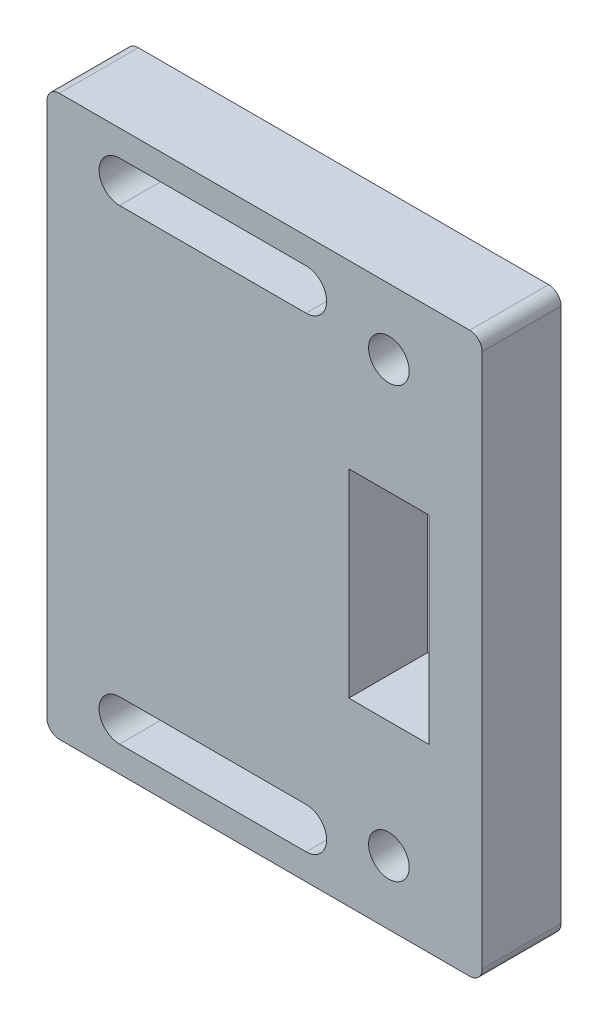
from build123d import *

# Parameters (mm, degrees)
SKETCH1_W                                        = 70
SKETCH1_H                                        = 90
BOSS_EXTRUDE1_DEPTH                              = 12.7
CSK_FOR_1_4_FLAT_HEAD_MACHINE_SCREW1_D           = 6.5278
CSK_FOR_1_4_FLAT_HEAD_MACHINE_SCREW1_CSINK_D     = 12.8778
CSK_FOR_1_4_FLAT_HEAD_MACHINE_SCREW1_CSINK_ANGLE = 82
FILLET1_R                                        = 2
CUT_EXTRUDE1_DEPTH                               = 115.72266559


with BuildPart() as part:
    # Sketch1 → Boss-Extrude1 (new body)
    with BuildSketch(Plane.XY):
        with Locations((35, -45)):
            Rectangle(SKETCH1_W, SKETCH1_H)
        Polygon((55, -29.025), (61.45, -29.025), (61.45, -60.975), (55, -60.975), (48.55, -60.975), (48.55, -29.025), align=None, mode=Mode.SUBTRACT)
    extrude(amount=BOSS_EXTRUDE1_DEPTH)

    # CSK for 1/4 Flat Head Machine Screw1 (through all)
    with Locations(Plane(origin=(0, 0, 0), x_dir=(-1, 0, 0), z_dir=(0, 0, -1))):
        with Locations((-55, -10.579610023), (-55, -79.699610023)):
            CounterSinkHole(CSK_FOR_1_4_FLAT_HEAD_MACHINE_SCREW1_D / 2, CSK_FOR_1_4_FLAT_HEAD_MACHINE_SCREW1_CSINK_D / 2, counter_sink_angle=CSK_FOR_1_4_FLAT_HEAD_MACHINE_SCREW1_CSINK_ANGLE)

    # Fillet1
    fillet1_edges = [part.edges().sort_by_distance(p)[0] for p in [
        (0, 0, 6.35),
        (70, 0, 6.35),
        (0, -90, 6.35),
        (70, -90, 6.35),
    ]]
    fillet(fillet1_edges, radius=FILLET1_R)

    # Sketch7 → Cut-Extrude1 (cut, through all)
    with BuildSketch(Plane(origin=(0, 0, 0), x_dir=(-1, 0, 0), z_dir=(0, 0, -1))):
        with BuildLine():
            Line((-41.687469931, -85.815), (-11.687469931, -85.815))
            ThreePointArc((-11.687469931, -85.815), (-8.387469931, -82.515), (-11.687469931, -79.215))
            Line((-11.687469931, -79.215), (-41.687469931, -79.215))
            ThreePointArc((-41.687469931, -79.215), (-44.987469931, -82.515), (-41.687469931, -85.815))
        make_face()
        with BuildLine():
            Line((-11.687469931, -10.785), (-41.687469931, -10.785))
            ThreePointArc((-41.687469931, -10.785), (-44.987469931, -7.485), (-41.687469931, -4.185))
            Line((-41.687469931, -4.185), (-11.687469931, -4.185))
            ThreePointArc((-11.687469931, -4.185), (-8.387469931, -7.485), (-11.687469931, -10.785))
        make_face()
    extrude(amount=-CUT_EXTRUDE1_DEPTH, mode=Mode.SUBTRACT)


solid = part.part
